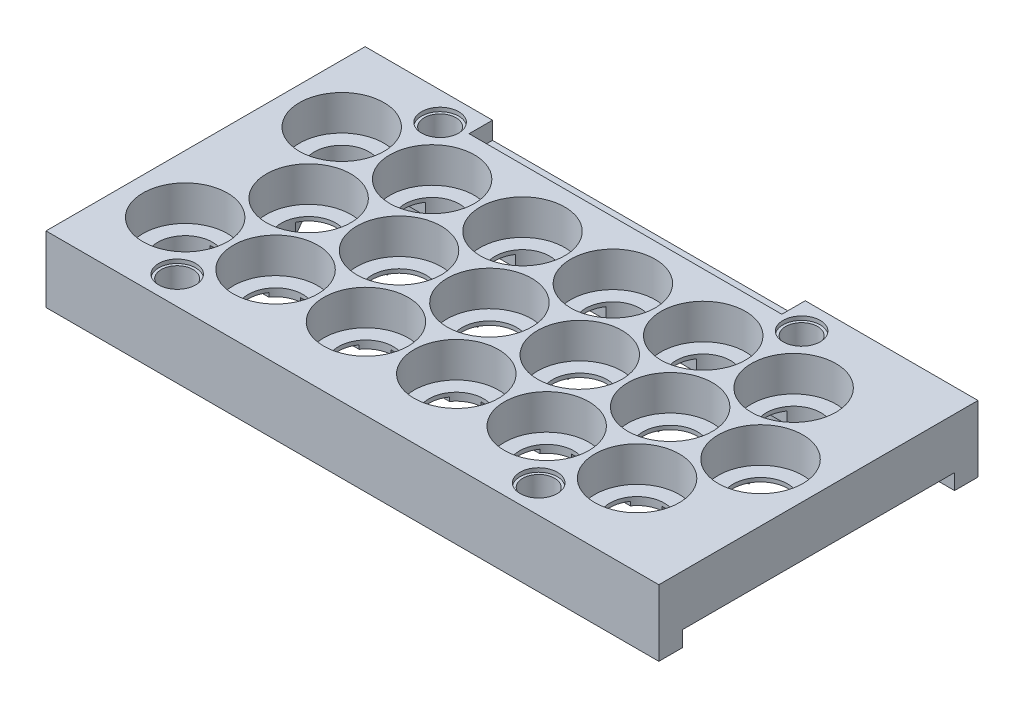
from build123d import *
from build123d.topology import SkipClean

# Parameters (mm, degrees)
SKETCH1_W            = 156.975
SKETCH1_H            = 81.746976195
SKETCH1_R            = 10.825
BOSS_EXTRUDE2_DEPTH  = 11
SKETCH1_3_R          = 10.825
SKETCH1_3_R_2        = 7
BOSS_EXTRUDE3_DEPTH  = 2
CUT_EXTRUDE1_DEPTH   = 1
CUT_EXTRUDE3_REACH   = 157.046
SKETCH9_R            = 4.0767
SKETCH10_R           = 4.7625
CUT_EXTRUDE4_DEPTH   = 1
SKETCH13_R           = 6.5
BOSS_EXTRUDE7_DEPTH  = 6
BOSS_EXTRUDE9_START  = 2
BOSS_EXTRUDE9_DEPTH  = 2
BOSS_EXTRUDE10_DEPTH = 2
SKETCH17_R           = 2
CUT_EXTRUDE5_DEPTH   = 4
SKETCH18_W           = 80.1
SKETCH18_H           = 4.475
CUT_EXTRUDE6_DEPTH   = 6
SKETCH19_R           = 2
CUT_EXTRUDE7_DEPTH   = 5


with BuildPart() as part:
    # Sketch1 → Boss-Extrude2 (new body)
    with BuildSketch(Plane(origin=(0, 0, 0), x_dir=(1, 0, 0), z_dir=(0, 1, 0))):
        with Locations((63.6625, -20.048488098)):
            Rectangle(SKETCH1_W, SKETCH1_H)
        with Locations((0, -40.096976195)):
            Circle(SKETCH1_R, mode=Mode.SUBTRACT)
        with Locations((23.15, -40.096976195)):
            Circle(SKETCH1_R, mode=Mode.SUBTRACT)
        with Locations((46.3, -40.096976195)):
            Circle(SKETCH1_R, mode=Mode.SUBTRACT)
        with Locations((69.45, -40.096976195)):
            Circle(SKETCH1_R, mode=Mode.SUBTRACT)
        with Locations((92.6, -40.096976195)):
            Circle(SKETCH1_R, mode=Mode.SUBTRACT)
        with Locations((115.75, -40.096976195)):
            Circle(SKETCH1_R, mode=Mode.SUBTRACT)
        with Locations((11.575, -20.048488098)):
            Circle(SKETCH1_R, mode=Mode.SUBTRACT)
        Circle(SKETCH1_R, mode=Mode.SUBTRACT)
        with Locations((23.15, 0)):
            Circle(SKETCH1_R, mode=Mode.SUBTRACT)
        with Locations((34.725, -20.048488098)):
            Circle(SKETCH1_R, mode=Mode.SUBTRACT)
        with Locations((57.875, -20.048488098)):
            Circle(SKETCH1_R, mode=Mode.SUBTRACT)
        with Locations((46.3, 0)):
            Circle(SKETCH1_R, mode=Mode.SUBTRACT)
        with Locations((81.025, -20.048488098)):
            Circle(SKETCH1_R, mode=Mode.SUBTRACT)
        with Locations((69.45, 0)):
            Circle(SKETCH1_R, mode=Mode.SUBTRACT)
        with Locations((92.6, 0)):
            Circle(SKETCH1_R, mode=Mode.SUBTRACT)
        with Locations((104.175, -20.048488098)):
            Circle(SKETCH1_R, mode=Mode.SUBTRACT)
        with Locations((127.325, -20.048488098)):
            Circle(SKETCH1_R, mode=Mode.SUBTRACT)
        with Locations((115.75, 0)):
            Circle(SKETCH1_R, mode=Mode.SUBTRACT)
    extrude(amount=BOSS_EXTRUDE2_DEPTH)

    # Sketch1<3> → Boss-Extrude3 (add)
    # profile 1 of 18: a face of its own
    with BuildSketch(Plane(origin=(0, 0, 0), x_dir=(1, 0, 0), z_dir=(0, 1, 0))):
        Circle(SKETCH1_3_R)
        Circle(SKETCH1_3_R_2, mode=Mode.SUBTRACT)
    # profile 2 of 18: a face of its own
    with BuildSketch(Plane(origin=(0, 0, 0), x_dir=(1, 0, 0), z_dir=(0, 1, 0))):
        with Locations((11.575, -20.048488098)):
            Circle(SKETCH1_3_R)
        with Locations((11.575, -20.048488098)):
            Circle(SKETCH1_3_R_2, mode=Mode.SUBTRACT)
    # profile 3 of 18: a face of its own
    with BuildSketch(Plane(origin=(0, 0, 0), x_dir=(1, 0, 0), z_dir=(0, 1, 0))):
        with Locations((0, -40.096976195)):
            Circle(SKETCH1_3_R)
        with Locations((0, -40.096976195)):
            Circle(SKETCH1_3_R_2, mode=Mode.SUBTRACT)
    # profile 4 of 18: a face of its own
    with BuildSketch(Plane(origin=(0, 0, 0), x_dir=(1, 0, 0), z_dir=(0, 1, 0))):
        with Locations((23.15, 0)):
            Circle(SKETCH1_3_R)
        with Locations((23.15, 0)):
            Circle(SKETCH1_3_R_2, mode=Mode.SUBTRACT)
    # profile 5 of 18: a face of its own
    with BuildSketch(Plane(origin=(0, 0, 0), x_dir=(1, 0, 0), z_dir=(0, 1, 0))):
        with Locations((34.725, -20.048488098)):
            Circle(SKETCH1_3_R)
        with Locations((34.725, -20.048488098)):
            Circle(SKETCH1_3_R_2, mode=Mode.SUBTRACT)
    # profile 6 of 18: a face of its own
    with BuildSketch(Plane(origin=(0, 0, 0), x_dir=(1, 0, 0), z_dir=(0, 1, 0))):
        with Locations((23.15, -40.096976195)):
            Circle(SKETCH1_3_R)
        with Locations((23.15, -40.096976195)):
            Circle(SKETCH1_3_R_2, mode=Mode.SUBTRACT)
    # profile 7 of 18: a face of its own
    with BuildSketch(Plane(origin=(0, 0, 0), x_dir=(1, 0, 0), z_dir=(0, 1, 0))):
        with Locations((46.3, 0)):
            Circle(SKETCH1_3_R)
        with Locations((46.3, 0)):
            Circle(SKETCH1_3_R_2, mode=Mode.SUBTRACT)
    # profile 8 of 18: a face of its own
    with BuildSketch(Plane(origin=(0, 0, 0), x_dir=(1, 0, 0), z_dir=(0, 1, 0))):
        with Locations((57.875, -20.048488098)):
            Circle(SKETCH1_3_R)
        with Locations((57.875, -20.048488098)):
            Circle(SKETCH1_3_R_2, mode=Mode.SUBTRACT)
    # profile 9 of 18: a face of its own
    with BuildSketch(Plane(origin=(0, 0, 0), x_dir=(1, 0, 0), z_dir=(0, 1, 0))):
        with Locations((46.3, -40.096976195)):
            Circle(SKETCH1_3_R)
        with Locations((46.3, -40.096976195)):
            Circle(SKETCH1_3_R_2, mode=Mode.SUBTRACT)
    # profile 10 of 18: a face of its own
    with BuildSketch(Plane(origin=(0, 0, 0), x_dir=(1, 0, 0), z_dir=(0, 1, 0))):
        with Locations((69.45, 0)):
            Circle(SKETCH1_3_R)
        with Locations((69.45, 0)):
            Circle(SKETCH1_3_R_2, mode=Mode.SUBTRACT)
    # profile 11 of 18: a face of its own
    with BuildSketch(Plane(origin=(0, 0, 0), x_dir=(1, 0, 0), z_dir=(0, 1, 0))):
        with Locations((81.025, -20.048488098)):
            Circle(SKETCH1_3_R)
        with Locations((81.025, -20.048488098)):
            Circle(SKETCH1_3_R_2, mode=Mode.SUBTRACT)
    # profile 12 of 18: a face of its own
    with BuildSketch(Plane(origin=(0, 0, 0), x_dir=(1, 0, 0), z_dir=(0, 1, 0))):
        with Locations((69.45, -40.096976195)):
            Circle(SKETCH1_3_R)
        with Locations((69.45, -40.096976195)):
            Circle(SKETCH1_3_R_2, mode=Mode.SUBTRACT)
    # profile 13 of 18: a face of its own
    with BuildSketch(Plane(origin=(0, 0, 0), x_dir=(1, 0, 0), z_dir=(0, 1, 0))):
        with Locations((92.6, 0)):
            Circle(SKETCH1_3_R)
        with Locations((92.6, 0)):
            Circle(SKETCH1_3_R_2, mode=Mode.SUBTRACT)
    # profile 14 of 18: a face of its own
    with BuildSketch(Plane(origin=(0, 0, 0), x_dir=(1, 0, 0), z_dir=(0, 1, 0))):
        with Locations((104.175, -20.048488098)):
            Circle(SKETCH1_3_R)
        with Locations((104.175, -20.048488098)):
            Circle(SKETCH1_3_R_2, mode=Mode.SUBTRACT)
    # profile 15 of 18: a face of its own
    with BuildSketch(Plane(origin=(0, 0, 0), x_dir=(1, 0, 0), z_dir=(0, 1, 0))):
        with Locations((92.6, -40.096976195)):
            Circle(SKETCH1_3_R)
        with Locations((92.6, -40.096976195)):
            Circle(SKETCH1_3_R_2, mode=Mode.SUBTRACT)
    # profile 16 of 18: a face of its own
    with BuildSketch(Plane(origin=(0, 0, 0), x_dir=(1, 0, 0), z_dir=(0, 1, 0))):
        with Locations((115.75, 0)):
            Circle(SKETCH1_3_R)
        with Locations((115.75, 0)):
            Circle(SKETCH1_3_R_2, mode=Mode.SUBTRACT)
    # profile 17 of 18: a face of its own
    with BuildSketch(Plane(origin=(0, 0, 0), x_dir=(1, 0, 0), z_dir=(0, 1, 0))):
        with Locations((127.325, -20.048488098)):
            Circle(SKETCH1_3_R)
        with Locations((127.325, -20.048488098)):
            Circle(SKETCH1_3_R_2, mode=Mode.SUBTRACT)
    # profile 18 of 18: a face of its own
    with BuildSketch(Plane(origin=(0, 0, 0), x_dir=(1, 0, 0), z_dir=(0, 1, 0))):
        with Locations((115.75, -40.096976195)):
            Circle(SKETCH1_3_R)
        with Locations((115.75, -40.096976195)):
            Circle(SKETCH1_3_R_2, mode=Mode.SUBTRACT)
    extrude(amount=BOSS_EXTRUDE3_DEPTH)

    # Sketch2 → Cut-Extrude1 (cut)
    with BuildSketch(Plane.XZ):
        with BuildLine():
            Line((-0.591820292, 33.12203901), (5.238617062, 23.023425283))
            ThreePointArc((5.238617062, 23.023425283), (8.075, 26.110665924), (12.166820292, 27.023425283))
            Line((12.166820292, 27.023425283), (6.92820323, 36.096976195))
            Line((6.92820323, 36.096976195), (17.405437353, 36.096976195))
            ThreePointArc((17.405437353, 36.096976195), (16.15, 40.096976195), (17.405437353, 44.096976195))
            Line((17.405437353, 44.096976195), (5.744562647, 44.096976195))
            ThreePointArc((5.744562647, 44.096976195), (6.062177826, 36.596976195), (-0.591820292, 33.12203901))
        make_face()
        with BuildLine():
            Line((27.79679677, 24.048488098), (17.319562647, 24.048488098))
            ThreePointArc((17.319562647, 24.048488098), (18.575, 20.048488098), (17.319562647, 16.048488098))
            Line((17.319562647, 16.048488098), (27.79679677, 16.048488098))
            Line((27.79679677, 16.048488098), (22.558179708, 6.974937186))
            ThreePointArc((22.558179708, 6.974937186), (26.124937186, 6.336382938), (28.894562647, 4))
            Line((28.894562647, 4), (6.92820323, 4))
            Line((6.92820323, 4), (12.166820292, 13.073550912))
            ThreePointArc((12.166820292, 13.073550912), (8.075, 13.986310271), (5.238617062, 17.073550912))
            Line((5.238617062, 17.073550912), (-0.591820292, 6.974937186))
            ThreePointArc((-0.591820292, 6.974937186), (2.974937186, 6.336382938), (5.744562647, 4))
            Line((5.744562647, 4), (0, 4))
            ThreePointArc((0, 4), (-4, 0), (0, -4))
            Line((0, -4), (115.75, -4))
            ThreePointArc((115.75, -4), (119.75, 0), (115.75, 4))
            Line((115.75, 4), (99.52820323, 4))
            Line((99.52820323, 4), (104.766820292, 13.073550912))
            ThreePointArc((104.766820292, 13.073550912), (97.175, 20.048488098), (104.766820292, 27.023425283))
            Line((104.766820292, 27.023425283), (99.52820323, 36.096976195))
            Line((99.52820323, 36.096976195), (110.005437353, 36.096976195))
            ThreePointArc((110.005437353, 36.096976195), (108.75, 40.096976195), (110.005437353, 44.096976195))
            Line((110.005437353, 44.096976195), (98.344562647, 44.096976195))
            ThreePointArc((98.344562647, 44.096976195), (98.662177826, 36.596976195), (92.008179708, 33.12203901))
            Line((92.008179708, 33.12203901), (97.24679677, 24.048488098))
            Line((97.24679677, 24.048488098), (86.769562647, 24.048488098))
            ThreePointArc((86.769562647, 24.048488098), (88.025, 20.048488098), (86.769562647, 16.048488098))
            Line((86.769562647, 16.048488098), (97.24679677, 16.048488098))
            Line((97.24679677, 16.048488098), (92.008179708, 6.974937186))
            ThreePointArc((92.008179708, 6.974937186), (95.574937186, 6.336382938), (98.344562647, 4))
            Line((98.344562647, 4), (76.37820323, 4))
            Line((76.37820323, 4), (81.616820292, 13.073550912))
            ThreePointArc((81.616820292, 13.073550912), (74.025, 20.048488098), (81.616820292, 27.023425283))
            Line((81.616820292, 27.023425283), (76.37820323, 36.096976195))
            Line((76.37820323, 36.096976195), (86.855437353, 36.096976195))
            ThreePointArc((86.855437353, 36.096976195), (85.6, 40.096976195), (86.855437353, 44.096976195))
            Line((86.855437353, 44.096976195), (75.194562647, 44.096976195))
            ThreePointArc((75.194562647, 44.096976195), (75.512177826, 36.596976195), (68.858179708, 33.12203901))
            Line((68.858179708, 33.12203901), (74.09679677, 24.048488098))
            Line((74.09679677, 24.048488098), (63.619562647, 24.048488098))
            ThreePointArc((63.619562647, 24.048488098), (64.875, 20.048488098), (63.619562647, 16.048488098))
            Line((63.619562647, 16.048488098), (74.09679677, 16.048488098))
            Line((74.09679677, 16.048488098), (68.858179708, 6.974937186))
            ThreePointArc((68.858179708, 6.974937186), (72.424937186, 6.336382938), (75.194562647, 4))
            Line((75.194562647, 4), (53.22820323, 4))
            Line((53.22820323, 4), (58.466820292, 13.073550912))
            ThreePointArc((58.466820292, 13.073550912), (50.875, 20.048488098), (58.466820292, 27.023425283))
            Line((58.466820292, 27.023425283), (53.22820323, 36.096976195))
            Line((53.22820323, 36.096976195), (63.705437353, 36.096976195))
            ThreePointArc((63.705437353, 36.096976195), (62.45, 40.096976195), (63.705437353, 44.096976195))
            Line((63.705437353, 44.096976195), (52.044562647, 44.096976195))
            ThreePointArc((52.044562647, 44.096976195), (52.362177826, 36.596976195), (45.708179708, 33.12203901))
            Line((45.708179708, 33.12203901), (50.94679677, 24.048488098))
            Line((50.94679677, 24.048488098), (40.469562647, 24.048488098))
            ThreePointArc((40.469562647, 24.048488098), (41.725, 20.048488098), (40.469562647, 16.048488098))
            Line((40.469562647, 16.048488098), (50.94679677, 16.048488098))
            Line((50.94679677, 16.048488098), (45.708179708, 6.974937186))
            ThreePointArc((45.708179708, 6.974937186), (49.274937186, 6.336382938), (52.044562647, 4))
            Line((52.044562647, 4), (30.07820323, 4))
            Line((30.07820323, 4), (35.316820292, 13.073550912))
            ThreePointArc((35.316820292, 13.073550912), (27.725, 20.048488098), (35.316820292, 27.023425283))
            Line((35.316820292, 27.023425283), (30.07820323, 36.096976195))
            Line((30.07820323, 36.096976195), (40.555437353, 36.096976195))
            ThreePointArc((40.555437353, 36.096976195), (39.3, 40.096976195), (40.555437353, 44.096976195))
            Line((40.555437353, 44.096976195), (28.894562647, 44.096976195))
            ThreePointArc((28.894562647, 44.096976195), (29.212177826, 36.596976195), (22.558179708, 33.12203901))
            Line((22.558179708, 33.12203901), (27.79679677, 24.048488098))
        make_face()
        with BuildLine():
            Line((127.916820292, 27.023425283), (122.086382938, 37.12203901))
            ThreePointArc((122.086382938, 37.12203901), (119.25, 34.034798369), (115.158179708, 33.12203901))
            Line((115.158179708, 33.12203901), (120.39679677, 24.048488098))
            Line((120.39679677, 24.048488098), (109.919562647, 24.048488098))
            ThreePointArc((109.919562647, 24.048488098), (111.175, 20.048488098), (109.919562647, 16.048488098))
            Line((109.919562647, 16.048488098), (120.39679677, 16.048488098))
            Line((120.39679677, 16.048488098), (115.158179708, 6.974937186))
            ThreePointArc((115.158179708, 6.974937186), (119.25, 6.062177826), (122.086382938, 2.974937186))
            Line((122.086382938, 2.974937186), (127.916820292, 13.073550912))
            ThreePointArc((127.916820292, 13.073550912), (120.325, 20.048488098), (127.916820292, 27.023425283))
        make_face()
    extrude(amount=-CUT_EXTRUDE1_DEPTH, mode=Mode.SUBTRACT)

    # Sketch9 → Cut-Extrude3 (cut, up to next)
    with BuildSketch(Plane(origin=(0, 11, 0), x_dir=(1, 0, 0), z_dir=(0, 1, 0)), mode=Mode.PRIVATE) as cut_extrude3_sk1:
        with Locations((11.575, 13.625)):
            Circle(SKETCH9_R)
    cut_extrude3_tool1 = extrude(cut_extrude3_sk1.sketch, amount=-CUT_EXTRUDE3_REACH, mode=Mode.PRIVATE) & part.part
    # Sketch9 → Cut-Extrude3 (cut, up to next)
    with BuildSketch(Plane(origin=(0, 11, 0), x_dir=(1, 0, 0), z_dir=(0, 1, 0)), mode=Mode.PRIVATE) as cut_extrude3_sk2:
        with Locations((11.575, -53.721976195)):
            Circle(SKETCH9_R)
    cut_extrude3_tool2 = extrude(cut_extrude3_sk2.sketch, amount=-CUT_EXTRUDE3_REACH, mode=Mode.PRIVATE) & part.part
    # Sketch9 → Cut-Extrude3 (cut, up to next)
    with BuildSketch(Plane(origin=(0, 11, 0), x_dir=(1, 0, 0), z_dir=(0, 1, 0)), mode=Mode.PRIVATE) as cut_extrude3_sk3:
        with Locations((104.175, -53.721976195)):
            Circle(SKETCH9_R)
    cut_extrude3_tool3 = extrude(cut_extrude3_sk3.sketch, amount=-CUT_EXTRUDE3_REACH, mode=Mode.PRIVATE) & part.part
    # Sketch9 → Cut-Extrude3 (cut, up to next)
    with BuildSketch(Plane(origin=(0, 11, 0), x_dir=(1, 0, 0), z_dir=(0, 1, 0)), mode=Mode.PRIVATE) as cut_extrude3_sk4:
        with Locations((104.175, 13.625)):
            Circle(SKETCH9_R)
    cut_extrude3_tool4 = extrude(cut_extrude3_sk4.sketch, amount=-CUT_EXTRUDE3_REACH, mode=Mode.PRIVATE) & part.part
    add(cut_extrude3_tool1.solids().sort_by_distance((11.575, 11, -13.625))[0], mode=Mode.SUBTRACT)
    add(cut_extrude3_tool2.solids().sort_by_distance((11.575, 11, 53.721976))[0], mode=Mode.SUBTRACT)
    add(cut_extrude3_tool3.solids().sort_by_distance((104.175, 11, 53.721976))[0], mode=Mode.SUBTRACT)
    add(cut_extrude3_tool4.solids().sort_by_distance((104.175, 11, -13.625))[0], mode=Mode.SUBTRACT)

    # Sketch10 → Cut-Extrude4 (cut)
    with BuildSketch(Plane(origin=(0, 11, 0), x_dir=(1, 0, 0), z_dir=(0, 1, 0))):
        with Locations((11.575, 13.625)):
            Circle(SKETCH10_R)
        with Locations((104.175, 13.625)):
            Circle(SKETCH10_R)
        with Locations((104.175, -53.721976195)):
            Circle(SKETCH10_R)
        with Locations((11.575, -53.721976195)):
            Circle(SKETCH10_R)
    extrude(amount=-CUT_EXTRUDE4_DEPTH, mode=Mode.SUBTRACT)

    # Sketch13 → Boss-Extrude7 (add)
    # profile 1 of 2: a face of its own
    with BuildSketch(Plane.XZ):
        with BuildLine():
            ThreePointArc((3.665512027, 54.921976195), (11.575, 45.721976195), (19.484487973, 54.921976195))
            Line((19.484487973, 54.921976195), (96.265512027, 54.921976195))
            ThreePointArc((96.265512027, 54.921976195), (104.175, 45.721976195), (112.084487973, 54.921976195))
            Line((112.084487973, 54.921976195), (142.15, 54.921976195))
            Line((142.15, 54.921976195), (142.15, 60.921976195))
            Line((142.15, 60.921976195), (-14.825, 60.921976195))
            Line((-14.825, 60.921976195), (-14.825, 54.921976195))
            Line((-14.825, 54.921976195), (3.665512027, 54.921976195))
        make_face()
        with Locations((11.575, 53.721976195)):
            Circle(SKETCH13_R, mode=Mode.SUBTRACT)
        with Locations((104.175, 53.721976195)):
            Circle(SKETCH13_R, mode=Mode.SUBTRACT)
    # profile 2 of 2: a face of its own
    with BuildSketch(Plane.XZ):
        with BuildLine():
            Line((-14.825, -14.825), (-14.825, -20.825))
            Line((-14.825, -20.825), (142.15, -20.825))
            Line((142.15, -20.825), (142.15, -14.825))
            Line((142.15, -14.825), (112.084487973, -14.825))
            ThreePointArc((112.084487973, -14.825), (104.175, -5.625), (96.265512027, -14.825))
            Line((96.265512027, -14.825), (19.484487973, -14.825))
            ThreePointArc((19.484487973, -14.825), (11.575, -5.625), (3.665512027, -14.825))
            Line((3.665512027, -14.825), (-14.825, -14.825))
        make_face()
        with Locations((11.575, -13.625)):
            Circle(SKETCH13_R, mode=Mode.SUBTRACT)
        with Locations((104.175, -13.625)):
            Circle(SKETCH13_R, mode=Mode.SUBTRACT)
    extrude(amount=BOSS_EXTRUDE7_DEPTH)

    # Sketch14 → Boss-Extrude9 (add)
    with SkipClean():  # the faces are left unmerged after this step: merging them gives an invalid solid
        with BuildSketch(Plane.XZ.offset(BOSS_EXTRUDE9_START)):
            with BuildLine():
                Line((142.15, 54.921976195), (142.15, -14.825))
                Line((142.15, -14.825), (112.084487973, -14.825))
                ThreePointArc((112.084487973, -14.825), (104.175, -5.625), (96.265512027, -14.825))
                Line((96.265512027, -14.825), (19.484487973, -14.825))
                ThreePointArc((19.484487973, -14.825), (11.575, -5.625), (3.665512027, -14.825))
                Line((3.665512027, -14.825), (-14.825, -14.825))
                Line((-14.825, -14.825), (-14.825, 54.921976195))
                Line((-14.825, 54.921976195), (3.665512027, 54.921976195))
                ThreePointArc((3.665512027, 54.921976195), (11.575, 45.721976195), (19.484487973, 54.921976195))
                Line((19.484487973, 54.921976195), (96.265512027, 54.921976195))
                ThreePointArc((96.265512027, 54.921976195), (104.175, 45.721976195), (112.084487973, 54.921976195))
                Line((112.084487973, 54.921976195), (142.15, 54.921976195))
            make_face()
            with BuildLine():
                Line((5.238617062, 17.073550912), (-0.591820292, 6.974937186))
                ThreePointArc((-0.591820292, 6.974937186), (-6.062177826, -3.5), (5.744562647, -4))
                Line((5.744562647, -4), (17.405437353, -4))
                ThreePointArc((17.405437353, -4), (23.15, -7), (28.894562647, -4))
                Line((28.894562647, -4), (40.555437353, -4))
                ThreePointArc((40.555437353, -4), (46.3, -7), (52.044562647, -4))
                Line((52.044562647, -4), (63.705437353, -4))
                ThreePointArc((63.705437353, -4), (69.45, -7), (75.194562647, -4))
                Line((75.194562647, -4), (86.855437353, -4))
                ThreePointArc((86.855437353, -4), (92.6, -7), (98.344562647, -4))
                Line((98.344562647, -4), (110.005437353, -4))
                ThreePointArc((110.005437353, -4), (119.25, -6.062177826), (122.086382938, 2.974937186))
                Line((122.086382938, 2.974937186), (127.916820292, 13.073550912))
                ThreePointArc((127.916820292, 13.073550912), (134.325, 20.048488098), (127.916820292, 27.023425283))
                Line((127.916820292, 27.023425283), (122.086382938, 37.12203901))
                ThreePointArc((122.086382938, 37.12203901), (119.25, 46.159154022), (110.005437353, 44.096976195))
                Line((110.005437353, 44.096976195), (98.344562647, 44.096976195))
                ThreePointArc((98.344562647, 44.096976195), (92.6, 47.096976195), (86.855437353, 44.096976195))
                Line((86.855437353, 44.096976195), (75.194562647, 44.096976195))
                ThreePointArc((75.194562647, 44.096976195), (69.45, 47.096976195), (63.705437353, 44.096976195))
                Line((63.705437353, 44.096976195), (52.044562647, 44.096976195))
                ThreePointArc((52.044562647, 44.096976195), (46.3, 47.096976195), (40.555437353, 44.096976195))
                Line((40.555437353, 44.096976195), (28.894562647, 44.096976195))
                ThreePointArc((28.894562647, 44.096976195), (23.15, 47.096976195), (17.405437353, 44.096976195))
                Line((17.405437353, 44.096976195), (5.744562647, 44.096976195))
                ThreePointArc((5.744562647, 44.096976195), (-6.062177826, 43.596976195), (-0.591820292, 33.12203901))
                Line((-0.591820292, 33.12203901), (5.238617062, 23.023425283))
                ThreePointArc((5.238617062, 23.023425283), (4.575, 20.048488098), (5.238617062, 17.073550912))
            make_face(mode=Mode.SUBTRACT)
        extrude(amount=-BOSS_EXTRUDE9_DEPTH)

    # Sketch16 → Boss-Extrude10 (add)
    with SkipClean():  # the faces are left unmerged after this step: merging them gives an invalid solid
        with BuildSketch(Plane.XZ):
            with BuildLine():
                Line((15.536128823, 32.859238845), (20.688871177, 29.884301659))
                ThreePointArc((20.688871177, 29.884301659), (21.237909283, 27.835263554), (19.188871177, 27.286225448))
                Line((19.188871177, 27.286225448), (14.036128823, 30.261162634))
                ThreePointArc((14.036128823, 30.261162634), (13.487090717, 32.310200739), (15.536128823, 32.859238845))
            make_face()
            with BuildLine():
                Line((38.686128823, 32.859238845), (43.838871177, 29.884301659))
                ThreePointArc((43.838871177, 29.884301659), (44.387909283, 27.835263554), (42.338871177, 27.286225448))
                Line((42.338871177, 27.286225448), (37.186128823, 30.261162634))
                ThreePointArc((37.186128823, 30.261162634), (36.637090717, 32.310200739), (38.686128823, 32.859238845))
            make_face()
            with BuildLine():
                Line((61.836128823, 32.859238845), (66.988871177, 29.884301659))
                ThreePointArc((66.988871177, 29.884301659), (67.537909283, 27.835263554), (65.488871177, 27.286225448))
                Line((65.488871177, 27.286225448), (60.336128823, 30.261162634))
                ThreePointArc((60.336128823, 30.261162634), (59.787090717, 32.310200739), (61.836128823, 32.859238845))
            make_face()
            with BuildLine():
                Line((84.986128823, 32.859238845), (90.138871177, 29.884301659))
                ThreePointArc((90.138871177, 29.884301659), (90.687909283, 27.835263554), (88.638871177, 27.286225448))
                Line((88.638871177, 27.286225448), (83.486128823, 30.261162634))
                ThreePointArc((83.486128823, 30.261162634), (82.937090717, 32.310200739), (84.986128823, 32.859238845))
            make_face()
            with BuildLine():
                Line((108.136128823, 32.859238845), (113.288871177, 29.884301659))
                ThreePointArc((113.288871177, 29.884301659), (113.837909283, 27.835263554), (111.788871177, 27.286225448))
                Line((111.788871177, 27.286225448), (106.636128823, 30.261162634))
                ThreePointArc((106.636128823, 30.261162634), (106.087090717, 32.310200739), (108.136128823, 32.859238845))
            make_face()
            with BuildLine():
                Line((15.536128823, 7.23773735), (20.688871177, 10.212674536))
                ThreePointArc((20.688871177, 10.212674536), (21.237909283, 12.261712642), (19.188871177, 12.810750747))
                Line((19.188871177, 12.810750747), (14.036128823, 9.835813562))
                ThreePointArc((14.036128823, 9.835813562), (13.487090717, 7.786775456), (15.536128823, 7.23773735))
            make_face()
            with BuildLine():
                Line((38.686128823, 7.23773735), (43.838871177, 10.212674536))
                ThreePointArc((43.838871177, 10.212674536), (44.387909283, 12.261712642), (42.338871177, 12.810750747))
                Line((42.338871177, 12.810750747), (37.186128823, 9.835813562))
                ThreePointArc((37.186128823, 9.835813562), (36.637090717, 7.786775456), (38.686128823, 7.23773735))
            make_face()
            with BuildLine():
                Line((61.836128823, 7.23773735), (66.988871177, 10.212674536))
                ThreePointArc((66.988871177, 10.212674536), (67.537909283, 12.261712642), (65.488871177, 12.810750747))
                Line((65.488871177, 12.810750747), (60.336128823, 9.835813562))
                ThreePointArc((60.336128823, 9.835813562), (59.787090717, 7.786775456), (61.836128823, 7.23773735))
            make_face()
            with BuildLine():
                Line((84.986128823, 7.23773735), (90.138871177, 10.212674536))
                ThreePointArc((90.138871177, 10.212674536), (90.687909283, 12.261712642), (88.638871177, 12.810750747))
                Line((88.638871177, 12.810750747), (83.486128823, 9.835813562))
                ThreePointArc((83.486128823, 9.835813562), (82.937090717, 7.786775456), (84.986128823, 7.23773735))
            make_face()
            with BuildLine():
                Line((108.136128823, 7.23773735), (113.288871177, 10.212674536))
                ThreePointArc((113.288871177, 10.212674536), (113.837909283, 12.261712642), (111.788871177, 12.810750747))
                Line((111.788871177, 12.810750747), (106.636128823, 9.835813562))
                ThreePointArc((106.636128823, 9.835813562), (106.087090717, 7.786775456), (108.136128823, 7.23773735))
            make_face()
        extrude(amount=BOSS_EXTRUDE10_DEPTH)

    # Sketch17 → Cut-Extrude5 (cut)
    with BuildSketch(Plane(origin=(0, -2, 0), x_dir=(-1, 0, 0), z_dir=(0, -1, 0))):
        with Locations((10.825, -49.509476195)):
            Circle(SKETCH17_R)
        with Locations((-57.875, -49.509476195)):
            Circle(SKETCH17_R)
        with Locations((-132.15, -49.509476195)):
            Circle(SKETCH17_R)
        with Locations((-132.15, 9.4125)):
            Circle(SKETCH17_R)
        with Locations((-57.875, 9.4125)):
            Circle(SKETCH17_R)
        with Locations((10.825, 9.4125)):
            Circle(SKETCH17_R)
    extrude(amount=-CUT_EXTRUDE5_DEPTH, mode=Mode.SUBTRACT)

    # Sketch18 → Cut-Extrude6 (cut)
    with BuildSketch(Plane(origin=(0, 0, -20.825), x_dir=(-1, 0, 0), z_dir=(0, 0, -1))):
        with Locations((-57.85, 8.7625)):
            Rectangle(SKETCH18_W, SKETCH18_H)
    extrude(amount=-CUT_EXTRUDE6_DEPTH, mode=Mode.SUBTRACT)

    # Sketch19 → Cut-Extrude7 (cut)
    with BuildSketch(Plane(origin=(0, 0, -20.825), x_dir=(-1, 0, 0), z_dir=(0, 0, -1))):
        with Locations((-85.9, 0.2625)):
            Circle(SKETCH19_R)
        with Locations((-29.8, 0.2625)):
            Circle(SKETCH19_R)
    extrude(amount=-CUT_EXTRUDE7_DEPTH, mode=Mode.SUBTRACT)


solid = part.part
